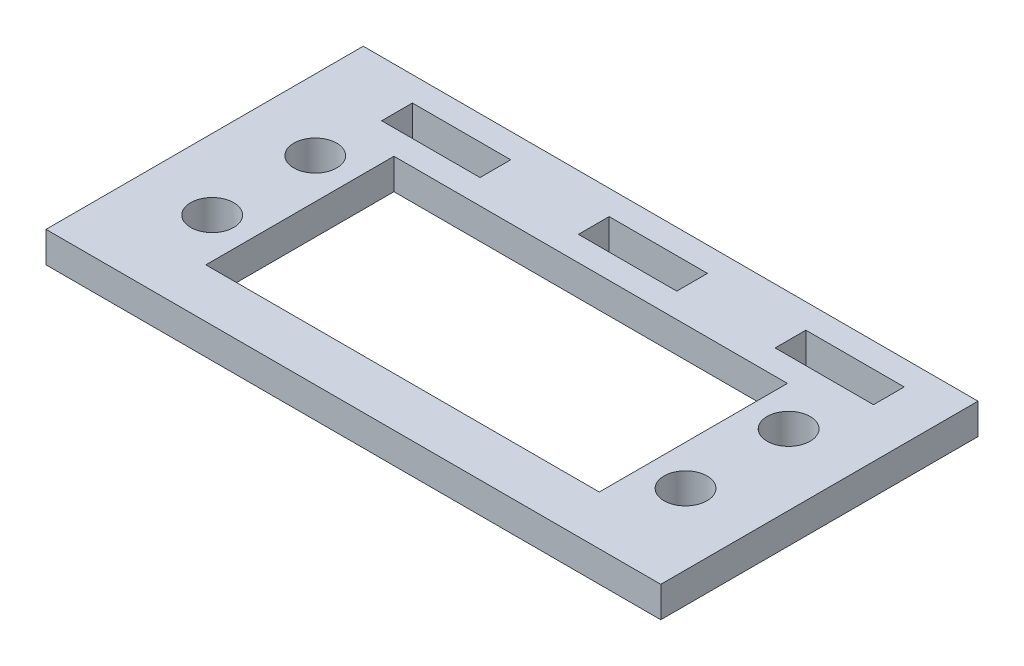
from build123d import *

# Parameters (mm, degrees)
SKETCH1_W           = 63.5
SKETCH1_H           = 32.766
SKETCH1_R           = 2.2225
SKETCH1_W_2         = 10.16
SKETCH1_H_2         = 3.175
SKETCH1_W_3         = 40.64
SKETCH1_H_3         = 19.431
BOSS_EXTRUDE2_DEPTH = 3.175


with BuildPart() as part:
    # Sketch1 → Boss-Extrude2 (new body)
    with BuildSketch(Plane(origin=(0, 0, 0), x_dir=(1, 0, 0), z_dir=(0, 1, 0))):
        with Locations((0, 1.5875)):
            Rectangle(SKETCH1_W, SKETCH1_H)
        with Locations((-24.4475, 5.711910092)):
            Circle(SKETCH1_R, mode=Mode.SUBTRACT)
        with Locations((-24.4475, -4.93498923)):
            Circle(SKETCH1_R, mode=Mode.SUBTRACT)
        with Locations((24.4475, 5.711910092)):
            Circle(SKETCH1_R, mode=Mode.SUBTRACT)
        with Locations((24.4475, -4.93498923)):
            Circle(SKETCH1_R, mode=Mode.SUBTRACT)
        with Locations((21.59, 13.843)):
            Rectangle(SKETCH1_W_2, SKETCH1_H_2, mode=Mode.SUBTRACT)
        with Locations((1.27, 13.843)):
            Rectangle(SKETCH1_W_2, SKETCH1_H_2, mode=Mode.SUBTRACT)
        with Locations((-19.05, 13.843)):
            Rectangle(SKETCH1_W_2, SKETCH1_H_2, mode=Mode.SUBTRACT)
        Rectangle(SKETCH1_W_3, SKETCH1_H_3, mode=Mode.SUBTRACT)
    extrude(amount=BOSS_EXTRUDE2_DEPTH)


solid = part.part
